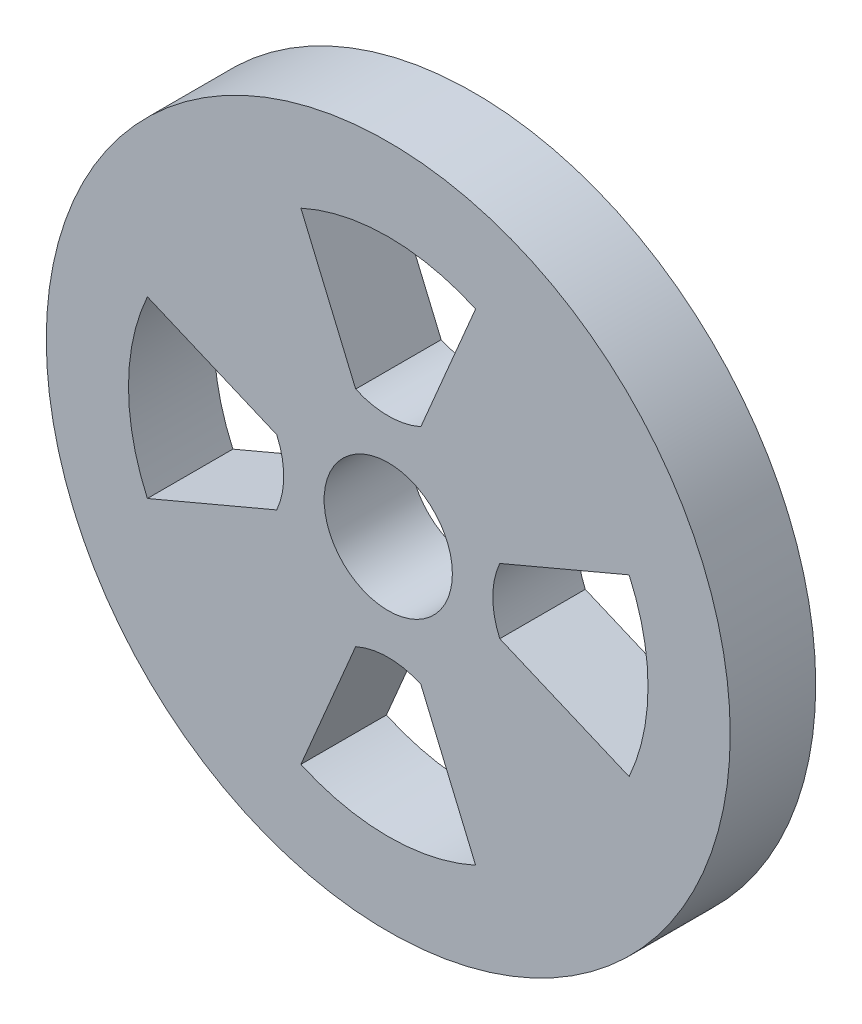
from build123d import *

# Parameters (mm, degrees)
SCHIZZO1_R                   = 80
SCHIZZO1_R_2                 = 15
ESTRUSIONE_ESTRUSIONE1_DEPTH = 10
TAGLIO_ESTRUSIONE1_DEPTH     = 115.891252931


with BuildPart() as part:
    # Schizzo1 → Estrusione-Estrusione1 (new, symmetric)
    with BuildSketch(Plane.XY):
        Circle(SCHIZZO1_R)
        Circle(SCHIZZO1_R_2, mode=Mode.SUBTRACT)
    extrude(amount=ESTRUSIONE_ESTRUSIONE1_DEPTH, both=True)

    # Schizzo2 → Taglio-Estrusione1 (cut, through all)
    with BuildSketch(Plane.XY.offset(10)):
        with BuildLine():
            Line((-20.433338025, 56.343896863), (-7.62437986, 26.089075757))
            ThreePointArc((-7.62437986, 26.089075757), (0, 24.449461913), (7.62437986, 26.089075757))
            Line((7.62437986, 26.089075757), (20.433338025, 56.343896863))
            ThreePointArc((20.433338025, 56.343896863), (0, 60.766823304), (-20.433338025, 56.343896863))
        make_face()
        with BuildLine():
            Line((56.343896863, -20.433338025), (26.089075757, -7.62437986))
            ThreePointArc((26.089075757, -7.62437986), (24.449461913, 0), (26.089075757, 7.62437986))
            Line((26.089075757, 7.62437986), (56.343896863, 20.433338025))
            ThreePointArc((56.343896863, 20.433338025), (60.766823304, 0), (56.343896863, -20.433338025))
        make_face()
        with BuildLine():
            Line((-20.433338025, -56.343896863), (-7.62437986, -26.089075757))
            ThreePointArc((-7.62437986, -26.089075757), (0, -24.449461913), (7.62437986, -26.089075757))
            Line((7.62437986, -26.089075757), (20.433338025, -56.343896863))
            ThreePointArc((20.433338025, -56.343896863), (0, -60.766823304), (-20.433338025, -56.343896863))
        make_face()
        with BuildLine():
            Line((-56.343896863, 20.433338025), (-26.089075757, 7.62437986))
            ThreePointArc((-26.089075757, 7.62437986), (-24.449461913, 0), (-26.089075757, -7.62437986))
            Line((-26.089075757, -7.62437986), (-56.343896863, -20.433338025))
            ThreePointArc((-56.343896863, -20.433338025), (-60.766823304, 0), (-56.343896863, 20.433338025))
        make_face()
    extrude(amount=-TAGLIO_ESTRUSIONE1_DEPTH, mode=Mode.SUBTRACT)


solid = part.part
